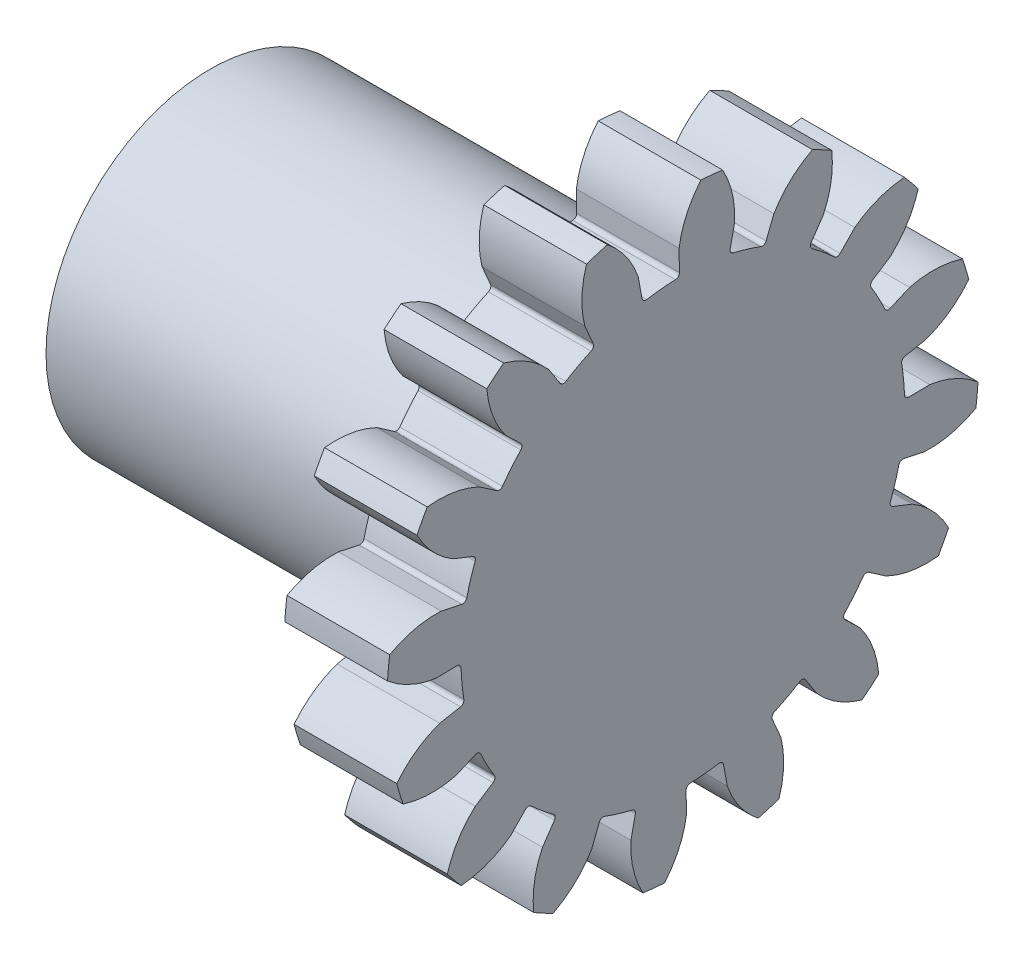
from build123d import *

# Parameters (mm, degrees)
SKETCH_2_R                       = 5.4
EXTRUDE_2_DEPTH                  = 2.5
SKETCH_5_R                       = 4
EXTRUDE_4_DEPTH                  = 9
HOLE_WIZARD_M31_D                = 2.5
HOLE_WIZARD_M31_DEPTH            = 8.5
HOLE_WIZARD_M31_CSINK_D          = 5
HOLE_WIZARD_M31_CSINK_ANGLE      = 90
HOLE_WIZARD_M31_TIP              = 0.751075774
EXTRUDE_5_REACH                  = 14.782
EXTRUDE_5_DIRECTION_2_REACH      = 14.782
FILLET_4_R                       = 0.1
PATTERN_CIRCULAR_1_COUNT         = 16
FILLET_4_OF_PATTERN_CIRCULAR_1_R = 0.1
FILLET_5_R                       = 0.2


with BuildPart() as part:
    # Эскиз2 → Бобышка-Вытянуть2 (new body)
    with BuildSketch(Plane(origin=(0, 0, 0), x_dir=(0, 0, -1), z_dir=(1, 0, 0))):
        Circle(SKETCH_2_R)
    extrude(amount=EXTRUDE_2_DEPTH)

    # Эскиз5 → Бобышка-Вытянуть4 (add)
    with BuildSketch(Plane.ZY):
        Circle(SKETCH_5_R)
    extrude(amount=EXTRUDE_4_DEPTH)

    # Отверстие обработанное метчиком M31
    with Locations(Plane.ZY.offset(9)):
        with Locations((0, 0)):
            CounterSinkHole(HOLE_WIZARD_M31_D / 2, HOLE_WIZARD_M31_CSINK_D / 2, depth=HOLE_WIZARD_M31_DEPTH, counter_sink_angle=HOLE_WIZARD_M31_CSINK_ANGLE)
            with Locations((0, 0, -(HOLE_WIZARD_M31_DEPTH + HOLE_WIZARD_M31_TIP / 2))):  # 118° drill point
                Cone(0, HOLE_WIZARD_M31_D / 2, HOLE_WIZARD_M31_TIP, mode=Mode.SUBTRACT)

    # Бобышка-Вытянуть5: up to this face of the body (flat: up to its plane)
    extrude_5_end = Plane(part.part.faces().sort_by_distance((2.5, 0, 0))[0])
    # Эскиз9 → Бобышка-Вытянуть5 (add, up to the picked face)
    with BuildSketch(Plane(origin=(1.25, 0, 0), x_dir=(0, 0, -1), z_dir=(1, 0, 0)), mode=Mode.PRIVATE) as extrude_5_sk1:
        with BuildLine():
            Line((-0.089632134, 6.013364805), (-0.080480693, 5.399400231))
            ThreePointArc((-0.080480693, 5.399400231), (0.529292558, 5.373997524), (1.132305009, 5.279951266))
            Line((1.132305009, 5.279951266), (1.261059154, 5.880333324))
            add(Edge.make_bspline(
                [(1.261059154, 5.880333324), (1.295696363, 6.538751311), (0.970178552, 7.134336239)],
                knots=[0, 0, 0, 1, 1, 1], degree=2))
            ThreePointArc((0.970178552, 7.134336239), (0.70572341, 7.165330032), (0.440303111, 7.186524415))
            add(Edge.make_bspline(
                [(-0.089632134, 6.013364805), (0.004847178, 6.665888859), (0.440303111, 7.186524415)],
                knots=[0, 0, 0, 1, 1, 1], degree=2))
        make_face()
    extrude_5_tool1 = split(extrude(extrude_5_sk1.sketch, amount=EXTRUDE_5_REACH, mode=Mode.PRIVATE), bisect_by=extrude_5_end, keep=Keep.BOTH, mode=Mode.PRIVATE)
    extrude_5 = extrude_5_tool1.solids().sort_by(Axis((1.25, 6.178183, -0.608498), (1, 0, 0)))[0]
    add(extrude_5)

    # Бобышка-Вытянуть5 direction 2: up to this face of the body (flat: up to its plane)
    extrude_5_direction_2_end = Plane(part.part.faces().sort_by_distance((0, 0, 5.247264935))[0])
    # Эскиз9 → Бобышка-Вытянуть5 direction 2 (add, up to the picked face)
    with BuildSketch(Plane(origin=(1.25, 0, 0), x_dir=(0, 0, -1), z_dir=(1, 0, 0)), mode=Mode.PRIVATE) as extrude_5_direction_2_sk1:
        with BuildLine():
            Line((-0.089632134, 6.013364805), (-0.080480693, 5.399400231))
            ThreePointArc((-0.080480693, 5.399400231), (0.529292558, 5.373997524), (1.132305009, 5.279951266))
            Line((1.132305009, 5.279951266), (1.261059154, 5.880333324))
            add(Edge.make_bspline(
                [(1.261059154, 5.880333324), (1.295696363, 6.538751311), (0.970178552, 7.134336239)],
                knots=[0, 0, 0, 1, 1, 1], degree=2))
            ThreePointArc((0.970178552, 7.134336239), (0.70572341, 7.165330032), (0.440303111, 7.186524415))
            add(Edge.make_bspline(
                [(-0.089632134, 6.013364805), (0.004847178, 6.665888859), (0.440303111, 7.186524415)],
                knots=[0, 0, 0, 1, 1, 1], degree=2))
        make_face()
    extrude_5_direction_2_tool1 = split(extrude(extrude_5_direction_2_sk1.sketch, amount=-EXTRUDE_5_DIRECTION_2_REACH, mode=Mode.PRIVATE), bisect_by=extrude_5_direction_2_end, keep=Keep.BOTH, mode=Mode.PRIVATE)
    extrude_5_direction_2 = extrude_5_direction_2_tool1.solids().sort_by(Axis((1.25, 6.178183, -0.608498), (-1, 0, 0)))[0]
    add(extrude_5_direction_2)

    # Скругление4
    fillet_4_edges = [part.edges().sort_by_distance(p)[0] for p in [
        (1.25, 5.399400231, 0.080480693),
        (1.25, 5.279951266, -1.132305009),
    ]]
    fillet(fillet_4_edges, radius=FILLET_4_R)

    # Круговой массив1: Бобышка-Вытянуть5, Бобышка-Вытянуть5 direction 2 ×16 about axis
    pattern_circular_1_axis = Axis((2.5, 0, 0), (-1, 0, 0))
    add([extrude_5.rotate(pattern_circular_1_axis, i * 360 / PATTERN_CIRCULAR_1_COUNT) for i in range(1, PATTERN_CIRCULAR_1_COUNT)])
    add([extrude_5_direction_2.rotate(pattern_circular_1_axis, i * 360 / PATTERN_CIRCULAR_1_COUNT) for i in range(1, PATTERN_CIRCULAR_1_COUNT)])

    # Скругление4 of Круговой массив1
    fillet_4_of_pattern_circular_1_edges = [part.edges().sort_by_distance(p)[0] for p in [
        (1.25, 5.019193989, -1.991906548),
        (1.25, 4.44472454, -3.066663295),
        (1.25, 3.874860962, -3.761044074),
        (1.25, 2.932828794, -4.534149894),
        (1.25, 2.140615478, -4.957596734),
        (1.25, 0.974436451, -5.311353274),
        (1.25, 0.080480693, -5.399400231),
        (1.25, -1.132305009, -5.279951266),
        (1.25, -1.991906548, -5.019193989),
        (1.25, -3.066663295, -4.44472454),
        (1.25, -3.761044074, -3.874860962),
        (1.25, -4.534149894, -2.932828794),
        (1.25, -4.957596734, -2.140615478),
        (1.25, -5.311353274, -0.974436451),
        (1.25, -5.399400231, -0.080480693),
        (1.25, -5.279951266, 1.132305009),
        (1.25, -5.019193989, 1.991906548),
        (1.25, -4.44472454, 3.066663295),
        (1.25, -3.874860962, 3.761044074),
        (1.25, -2.932828794, 4.534149894),
        (1.25, -2.140615478, 4.957596734),
        (1.25, -0.974436451, 5.311353274),
        (1.25, -0.080480693, 5.399400231),
        (1.25, 1.132305009, 5.279951266),
        (1.25, 1.991906548, 5.019193989),
        (1.25, 3.066663295, 4.44472454),
        (1.25, 3.761044074, 3.874860962),
        (1.25, 4.534149894, 2.932828794),
        (1.25, 4.957596734, 2.140615478),
        (1.25, 5.311353274, 0.974436451),
    ]]
    fillet(fillet_4_of_pattern_circular_1_edges, radius=FILLET_4_OF_PATTERN_CIRCULAR_1_R)

    # Эскиз11 → Вырез-Повернуть3 (revolve, cut)
    with BuildSketch(Plane.XY):
        Polygon((0, 4), (0, 3.7), (-0.5, 3.7), (-0.8, 4), align=None)
    revolve(axis=Axis((-9, 0, 0), (1, 0, 0)), mode=Mode.SUBTRACT)

    # Скругление5
    fillet_5_edges = [part.edges().sort_by_distance(p)[0] for p in [
        (-0.5, -3.7, 0),
        (0, -3.7, 0),
    ]]
    fillet(fillet_5_edges, radius=FILLET_5_R)


solid = part.part
